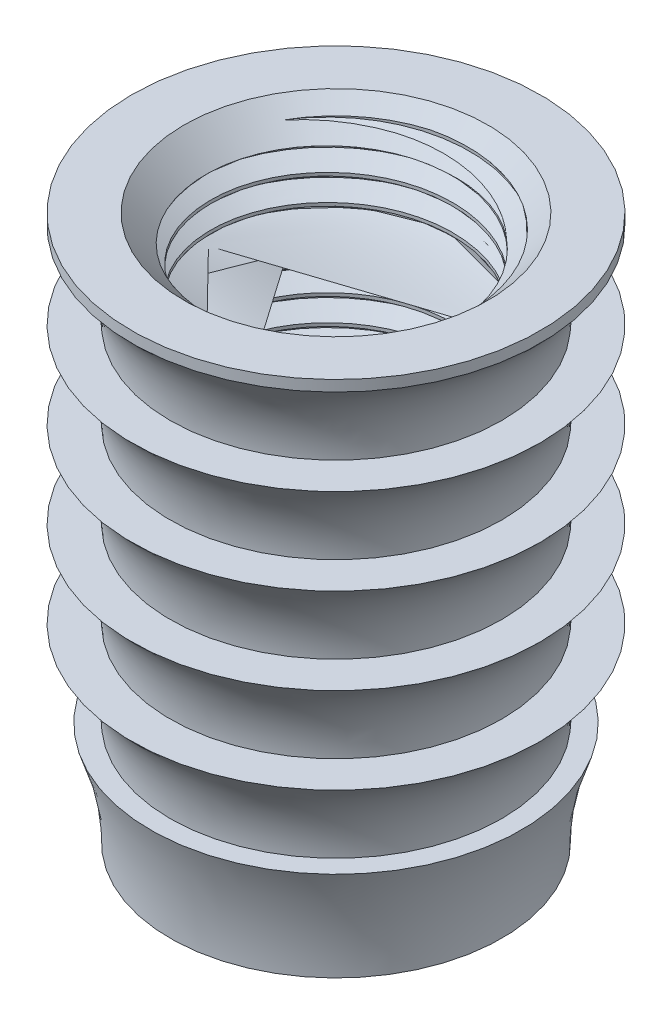
from build123d import *

# Parameters (mm, degrees)
LPATTERN1_COUNT     = 4
LPATTERN1_PITCH     = 1.50495
SKETCH3_W           = 2.413
SKETCH3_H           = 9.525
CUT_SWEEP1_PITCH    = 0.45466
SKETCH7_R           = 2.6543
BOSS_EXTRUDE1_DEPTH = 9.525


with BuildPart() as part:
    # Sketch2 → Revolve1 (revolve)
    with BuildSketch(Plane.XY):
        with BuildLine():
            Line((-3.5687, 4.7625), (-3.5687, 4.572))
            ThreePointArc((-3.5687, 4.572), (-3.071541103, 3.891358515), (-2.8956, 3.06705))
            Line((-2.8956, 3.06705), (-2.8956, -2.95275))
            Line((-2.8956, -2.95275), (-3.2385, -2.95275))
            ThreePointArc((-3.2385, -2.95275), (-2.982080879, -3.841525588), (-2.8956, -4.7625))
            Line((-2.8956, -4.7625), (-2.6543, -4.7625))
            Line((-2.6543, -4.7625), (-2.413, -4.5212))
            Line((-2.413, -4.5212), (-2.413, 4.5212))
            Line((-2.413, 4.5212), (-2.6543, 4.7625))
            Line((-2.6543, 4.7625), (-3.5687, 4.7625))
        make_face()
    revolve(axis=Axis((0, 4.7625, 0), (0, -1, 0)))

    # Sketch10 → Revolve5 (revolve)
    with BuildSketch(Plane.XY):
        with BuildLine():
            Line((-2.8956, 3.06705), (-2.8956, 1.5621))
            ThreePointArc((-2.8956, 1.5621), (-3.071541103, 2.386408515), (-3.5687, 3.06705))
            Line((-3.5687, 3.06705), (-2.8956, 3.06705))
        make_face()
    revolve5 = revolve(axis=Axis((0, -4.7625, 0), (0, 1, 0)))

    # LPattern1: Revolve5 ×4
    with Locations(*[(0, -i * LPATTERN1_PITCH, 0) for i in range(1, LPATTERN1_COUNT)]):
        add(revolve5)

    # Sketch7 → Boss-Extrude1 (add)
    with BuildSketch(Plane.XZ.offset(4.7625)):
        Circle(SKETCH7_R)
    extrude(amount=-BOSS_EXTRUDE1_DEPTH)


with BuildPart() as body_2:
    # Sketch3 → Revolve2 (revolve)
    with BuildSketch(Plane.XY, mode=Mode.PRIVATE) as revolve2_sk:
        with Locations((-1.2065, 0)):
            Rectangle(SKETCH3_W, SKETCH3_H)
    revolve(revolve2_sk.sketch.rotate(Axis((0, -4.7625, 0), (0, 1, 0)), 180), axis=Axis((0, -4.7625, 0), (0, 1, 0)))

    # Cut-Sweep1: the profile of Sketch5 screwed along a right-hand helix of 22.695531 turns, 6 arcs to a turn; built about Z, then put on its axis
    cut_sweep1_z = Axis((0, 0, 0), (0, 0, 1))
    cut_sweep1_corners = [(2.4613935, 0, 0.02794), (2.43719675, 0, -0.41275), (2.116039889, 0, -0.22733), (2.116039889, 0, -0.17145)]
    with BuildLine(mode=Mode.PRIVATE) as cut_sweep1_profile:
        Line(cut_sweep1_corners[0], cut_sweep1_corners[1])
        Line(cut_sweep1_corners[1], cut_sweep1_corners[2])
        Line(cut_sweep1_corners[2], cut_sweep1_corners[3])
        Line(cut_sweep1_corners[3], cut_sweep1_corners[0])
    cut_sweep1_cap = Face(cut_sweep1_profile.wire())
    cut_sweep1_turn_angles = [0, 30, 60, 90, 120, 150, 180, 210, 240, 270, 300, 330, 360]
    cut_sweep1_turn_weights = [1, 0.8660254037844387, 1, 0.8660254037844387, 1, 0.8660254037844387, 1, 0.8660254037844387, 1, 0.8660254037844387, 1, 0.8660254037844387, 1]
    cut_sweep1_turn_rails = [Edge.make_bspline([Vector(p[0], p[1], 0).rotate(cut_sweep1_z, cut_sweep1_turn_angles[k]) / cut_sweep1_turn_weights[k] + Vector(0, 0, p[2] + CUT_SWEEP1_PITCH * cut_sweep1_turn_angles[k] / 360) for k in range(13)], [0, 0, 0, 1, 1, 2, 2, 3, 3, 4, 4, 5, 5, 6, 6, 6], 2, cut_sweep1_turn_weights) for p in cut_sweep1_corners]
    cut_sweep1_turn_sides = [Face.make_surface_from_curves(cut_sweep1_turn_rails[p[0]], cut_sweep1_turn_rails[p[1]]) for p in [(0, 1), (1, 2), (2, 3), (3, 0)]]
    cut_sweep1_last_angles = [7920, 7950, 7980, 8010, 8040, 8070, 8100, 8130, 8160, 8165.195530726, 8170.391061453]
    cut_sweep1_last_weights = [1, 0.8660254037844387, 1, 0.8660254037844387, 1, 0.8660254037844387, 1, 0.8660254037844387, 1, 0.9958914652484562, 1]
    cut_sweep1_last_rails = [Edge.make_bspline([Vector(p[0], p[1], 0).rotate(cut_sweep1_z, cut_sweep1_last_angles[k]) / cut_sweep1_last_weights[k] + Vector(0, 0, p[2] + CUT_SWEEP1_PITCH * cut_sweep1_last_angles[k] / 360) for k in range(11)], [0, 0, 0, 1, 1, 2, 2, 3, 3, 4, 4, 5, 5, 5], 2, cut_sweep1_last_weights) for p in cut_sweep1_corners]
    cut_sweep1_last_sides = [Face.make_surface_from_curves(cut_sweep1_last_rails[p[0]], cut_sweep1_last_rails[p[1]]) for p in [(0, 1), (1, 2), (2, 3), (3, 0)]]
    cut_sweep1 = Plane(origin=(0, -4.7625, 0), x_dir=(1, 0, 0), z_dir=(0, 1, 0)) * Solid(Shell([*[p.moved(Location((0, 0, CUT_SWEEP1_PITCH * i))) for i in range(22) for p in cut_sweep1_turn_sides], *cut_sweep1_last_sides, cut_sweep1_cap, cut_sweep1_cap.rotate(cut_sweep1_z, 8170.391061453).moved(Location((0, 0, CUT_SWEEP1_PITCH * 8170.391061453 / 360)))]))
    add(cut_sweep1, mode=Mode.SUBTRACT)

    # Sketch6 → Revolve3 (revolve)
    with BuildSketch(Plane.XY, mode=Mode.PRIVATE) as revolve3_sk:
        Polygon((-2.6543, -4.7625), (0, -2.1082), (0, -4.7625), align=None)
    revolve(revolve3_sk.sketch.rotate(Axis((0, 4.7625, 0), (0, -1, 0)), 180), axis=Axis((0, 4.7625, 0), (0, -1, 0)))

    # Sketch9 → Revolve4 (revolve)
    with BuildSketch(Plane.XY, mode=Mode.PRIVATE) as revolve4_sk:
        Polygon((0, 4.7625), (0, 2.1082), (-2.6543, 4.7625), align=None)
    revolve(revolve4_sk.sketch.rotate(Axis((0, 4.7625, 0), (0, -1, 0)), 180), axis=Axis((0, 4.7625, 0), (0, -1, 0)))


with BuildPart() as part_1:
    add(part.part)

    # Combine1: cut body 2
    add(body_2.part, mode=Mode.SUBTRACT)


solid = part_1.part
